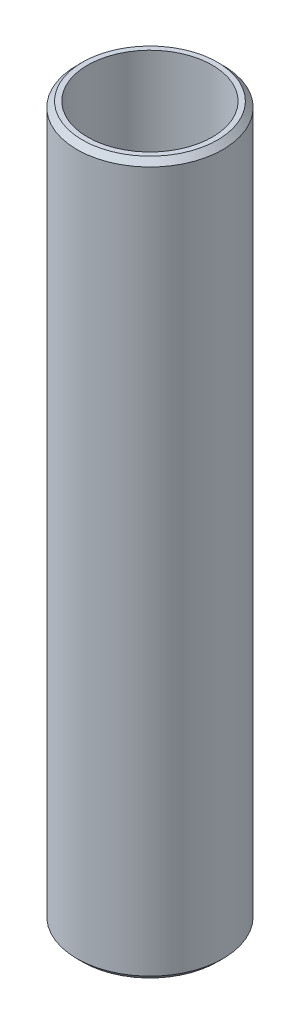
from build123d import *

# Parameters (mm, degrees)
SKETCH1_R           = 60
BOSS_EXTRUDE1_DEPTH = 585.043131397
SKETCH2_R           = 51.270512469
CUT_EXTRUDE1_DEPTH  = 592.164499606
CHAMFER1_SIZE       = 4.517317691


with BuildPart() as part:
    # Sketch1 → Boss-Extrude1 (new body)
    with BuildSketch(Plane(origin=(0, 0, 0), x_dir=(1, 0, 0), z_dir=(0, 1, 0))):
        Circle(SKETCH1_R)
    extrude(amount=BOSS_EXTRUDE1_DEPTH)

    # Sketch2 → Cut-Extrude1 (cut, through all)
    with BuildSketch(Plane(origin=(0, 0, 0), x_dir=(1, 0, 0), z_dir=(0, 1, 0))):
        Circle(SKETCH2_R)
    extrude(amount=CUT_EXTRUDE1_DEPTH, mode=Mode.SUBTRACT)

    # Chamfer1
    chamfer1_edges = [part.edges().sort_by_distance(p)[0] for p in [
        (-60, 585.043131397, 0),
        (-60, 0, 0),
    ]]
    chamfer(chamfer1_edges, length=CHAMFER1_SIZE)


solid = part.part
